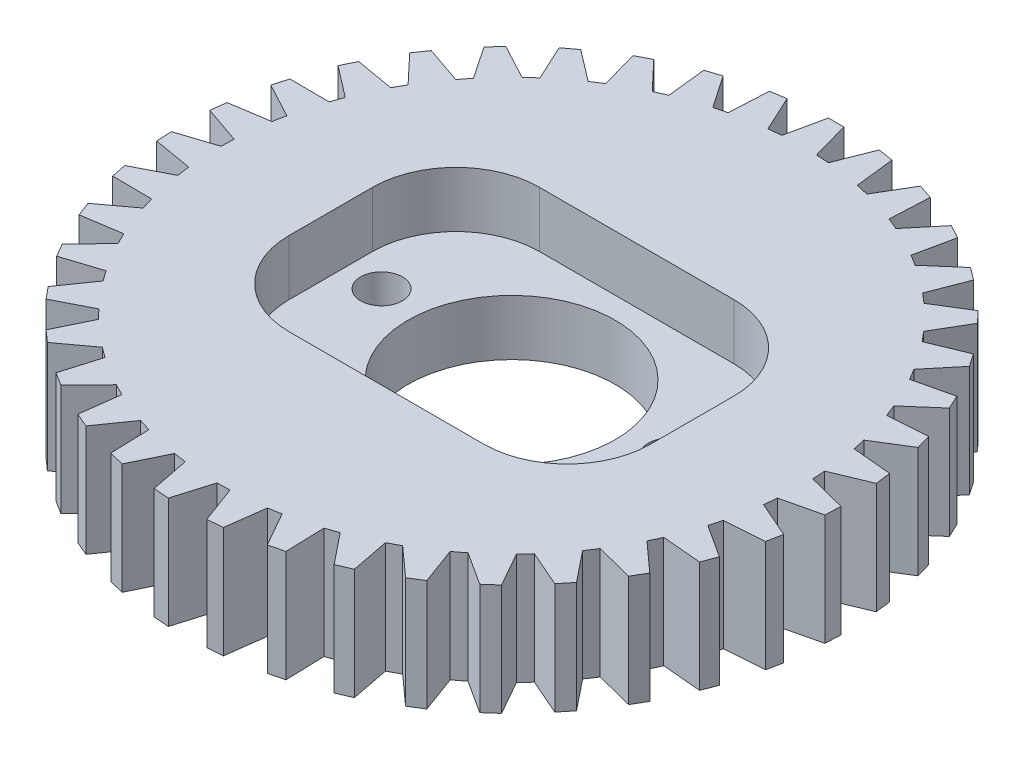
from build123d import *

# Parameters (mm, degrees)
SKETCH2_R           = 10.5
BOSS_EXTRUDE1_DEPTH = 4
SKETCH3_W           = 13
SKETCH3_H           = 9
CUT_EXTRUDE1_DEPTH  = 2
FILLET1_R           = 3
SKETCH4_R           = 3.725
SKETCH4_R_2         = 0.75
CUT_EXTRUDE2_DEPTH  = 15.983324064
BOSS_EXTRUDE2_START = -4
BOSS_EXTRUDE2_DEPTH = 4


with BuildPart() as part:
    # Sketch2 → Boss-Extrude1 (new body)
    with BuildSketch(Plane(origin=(0, 0, 0), x_dir=(1, 0, 0), z_dir=(0, 1, 0))):
        Circle(SKETCH2_R)
    extrude(amount=BOSS_EXTRUDE1_DEPTH)

    # Sketch3 → Cut-Extrude1 (cut)
    with BuildSketch(Plane(origin=(0, 4, 0), x_dir=(1, 0, 0), z_dir=(0, 1, 0))):
        Rectangle(SKETCH3_W, SKETCH3_H)
    extrude(amount=-CUT_EXTRUDE1_DEPTH, mode=Mode.SUBTRACT)

    # Fillet1
    fillet1_edges = [part.edges().sort_by_distance(p)[0] for p in [
        (-6.5, 3, 4.5),
        (6.5, 3, 4.5),
        (-6.5, 3, -4.5),
        (6.5, 3, -4.5),
    ]]
    fillet(fillet1_edges, radius=FILLET1_R)

    # Sketch4 → Cut-Extrude2 (cut, through all)
    with BuildSketch(Plane(origin=(0, 2, 0), x_dir=(1, 0, 0), z_dir=(0, 1, 0))):
        Circle(SKETCH4_R)
        with Locations((-5.176126951, 0.497704515)):
            Circle(SKETCH4_R_2)
        with Locations((5.176126951, 0.497704515)):
            Circle(SKETCH4_R_2)
    extrude(amount=-CUT_EXTRUDE2_DEPTH, mode=Mode.SUBTRACT)

    # Sketch5 → Boss-Extrude2 (add)
    with BuildSketch(Plane(origin=(0, 4, 0), x_dir=(1, 0, 0), z_dir=(0, 1, 0)).offset(BOSS_EXTRUDE2_START)):
        with BuildLine():
            Line((-0.757628273, 10.472630968), (-0.46141818, 11.853816835))
            Line((-0.46141818, 11.853816835), (0.093861365, 11.853816835))
            Line((0.093861365, 11.853816835), (0.477738985, 10.489126058))
            ThreePointArc((0.477738985, 10.489126058), (-0.140187465, 10.499064124), (-0.757628273, 10.472630968))
        make_face()
        with BuildLine():
            Line((1.994131826, 11.685256599), (2.154126537, 10.276659908))
            ThreePointArc((2.154126537, 10.276659908), (1.54579625, 10.385591652), (0.932110962, 10.45854527))
            Line((0.932110962, 10.45854527), (1.446043006, 11.774329702))
            Line((1.446043006, 11.774329702), (1.994131826, 11.685256599))
        make_face()
        with BuildLine():
            Line((3.842755321, 11.214054354), (3.774723342, 9.798033664))
            ThreePointArc((3.774723342, 9.798033664), (3.191744654, 10.003137811), (2.597709012, 10.173588742))
            Line((2.597709012, 10.173588742), (3.316052437, 11.389893614))
            Line((3.316052437, 11.389893614), (3.842755321, 11.214054354))
        make_face()
        with BuildLine():
            Line((5.591853472, 10.452413992), (5.297556797, 9.065643495))
            ThreePointArc((5.297556797, 9.065643495), (4.755028547, 9.361607956), (4.196027764, 9.62514161))
            Line((4.196027764, 9.62514161), (5.100177852, 10.710465264))
            Line((5.100177852, 10.710465264), (5.591853472, 10.452413992))
        make_face()
        with BuildLine():
            Line((7.196125554, 9.420061599), (6.683186312, 8.098457922))
            ThreePointArc((6.683186312, 8.098457922), (6.1951597, 8.477617371), (5.6856716, 8.827408366))
            Line((5.6856716, 8.827408366), (6.75221134, 9.75364149))
            Line((6.75221134, 9.75364149), (7.196125554, 9.420061599))
        make_face()
        with BuildLine():
            Line((8.614021765, 8.143734558), (7.895724813, 6.921526542))
            ThreePointArc((7.895724813, 6.921526542), (7.47483947, 7.37406095), (7.028059529, 7.801049882))
            Line((7.028059529, 7.801049882), (8.229366101, 8.544203525))
            Line((8.229366101, 8.544203525), (8.614021765, 8.143734558))
        make_face()
        with BuildLine():
            Line((9.808819337, 6.656489069), (8.903768189, 5.565331261))
            ThreePointArc((8.903768189, 5.565331261), (8.560924824, 6.079520224), (8.188424408, 6.572648304))
            Line((8.188424408, 6.572648304), (9.493384603, 7.113475176))
            Line((9.493384603, 7.113475176), (9.808819337, 6.656489069))
        make_face()
        with BuildLine():
            Line((10.74957364, 4.996844011), (9.681208645, 4.064996823))
            ThreePointArc((9.681208645, 4.064996823), (9.425286722, 4.627523118), (9.136713395, 5.174018587))
            Line((9.136713395, 5.174018587), (10.51152943, 5.498511557))
            Line((10.51152943, 5.498511557), (10.74957364, 4.996844011))
        make_face()
        with BuildLine():
            Line((11.411919633, 3.207783317), (10.207910883, 2.459381103))
            ThreePointArc((10.207910883, 2.459381103), (10.045538645, 3.055675593), (9.848366305, 3.641384506))
            Line((9.848366305, 3.641384506), (11.257431166, 3.741139377))
            Line((11.257431166, 3.741139377), (11.411919633, 3.207783317))
        make_face()
        with BuildLine():
            Line((11.778702901, 1.33564272), (10.470233591, 0.790068704))
            ThreePointArc((10.470233591, 0.790068704), (10.405616394, 1.404687676), (10.304951701, 2.01444048))
            Line((10.304951701, 2.01444048), (11.711771349, 1.886873652))
            Line((11.711771349, 1.886873652), (11.778702901, 1.33564272))
        make_face()
        with BuildLine():
            Line((11.840423952, -0.571090322), (10.461382748, -0.899706059))
            ThreePointArc((10.461382748, -0.899706059), (10.496194144, -0.282680914), (10.49464426, 0.335323503))
            Line((10.49464426, 0.335323503), (11.862782805, -0.01626111))
            Line((11.862782805, -0.01626111), (11.840423952, -0.571090322))
        make_face()
        with BuildLine():
            Line((11.595484241, -2.463032424), (10.181587588, -2.566178908))
            ThreePointArc((10.181587588, -2.566178908), (10.314925979, -1.962728218), (10.412531046, -1.352478176))
            Line((10.412531046, -1.352478176), (11.706554418, -1.918974717))
            Line((11.706554418, -1.918974717), (11.595484241, -2.463032424))
        make_face()
        with BuildLine():
            Line((11.05022758, -4.291183281), (9.638094657, -4.166189072))
            ThreePointArc((9.638094657, -4.166189072), (9.866506649, -3.591941891), (10.060738747, -3.005251381))
            Line((10.060738747, -3.005251381), (11.24713242, -3.771987887))
            Line((11.24713242, -3.771987887), (11.05022758, -4.291183281))
        make_face()
        with BuildLine():
            Line((10.218775829, -6.008194744), (8.844980137, -5.658297126))
            ThreePointArc((8.844980137, -5.658297126), (9.16254998, -5.128126156), (9.448378599, -4.580190153))
            Line((9.448378599, -4.580190153), (10.496415601, -5.527308552))
            Line((10.496415601, -5.527308552), (10.218775829, -6.008194744))
        make_face()
        with BuildLine():
            Line((9.122663151, -7.569597119), (7.822785278, -7.003858258))
            ThreePointArc((7.822785278, -7.003858258), (8.221288079, -6.531494647), (8.591310409, -6.036504407))
            Line((8.591310409, -6.036504407), (9.473847131, -7.139474829))
            Line((9.473847131, -7.139474829), (9.122663151, -7.569597119))
        make_face()
        with BuildLine():
            Line((7.79027829, -8.934950906), (6.597984389, -8.168023139))
            ThreePointArc((6.597984389, -8.168023139), (7.067099135, -7.765700858), (7.511731792, -7.336476367))
            Line((7.511731792, -7.336476367), (8.205910997, -8.566732458))
            Line((8.205910997, -8.566732458), (7.79027829, -8.934950906))
        make_face()
        with BuildLine():
            Line((6.256129313, -10.068894157), (5.20229917, -9.120640512))
            ThreePointArc((5.20229917, -9.120640512), (5.729876036, -8.798779496), (6.237603267, -8.446437443))
            Line((6.237603267, -8.446437443), (6.725446079, -9.772116216))
            Line((6.725446079, -9.772116216), (6.256129313, -10.068894157))
        make_face()
        with BuildLine():
            Line((4.559949873, -10.942058338), (3.671877136, -9.837038086))
            ThreePointArc((3.671877136, -9.837038086), (4.244252157, -9.603974366), (4.801924094, -9.337640226))
            Line((4.801924094, -9.337640226), (5.07079564, -10.724407297))
            Line((5.07079564, -10.724407297), (4.559949873, -10.942058338))
        make_face()
        with BuildLine():
            Line((2.745670126, -11.531828956), (2.046355412, -10.298661541))
            ThreePointArc((2.046355412, -10.298661541), (2.648704377, -10.160431345), (3.241877609, -9.987003032))
            Line((3.241877609, -9.987003032), (3.284814257, -11.398941863))
            Line((3.284814257, -11.398941863), (2.745670126, -11.531828956))
        make_face()
        with BuildLine():
            Line((0.860278966, -11.822931262), (0.367834158, -10.493555071))
            ThreePointArc((0.367834158, -10.493555071), (0.984556545, -10.45373849), (1.597868197, -10.377707706))
            Line((1.597868197, -10.377707706), (1.41375791, -11.778249822))
            Line((1.41375791, -11.778249822), (0.860278966, -11.822931262))
        make_face()
        with BuildLine():
            Line((-1.047392968, -11.807825858), (-1.320213807, -10.416671037))
            ThreePointArc((-1.320213807, -10.416671037), (-0.705090784, -10.476299298), (-0.087525162, -10.499635201))
            Line((-0.087525162, -10.499635201), (-0.493914024, -11.852507297))
            Line((-0.493914024, -11.852507297), (-1.047392968, -11.807825858))
        make_face()
        with BuildLine():
            Line((-2.927937974, -11.486903966), (-2.974068929, -10.070000696))
            ThreePointArc((-2.974068929, -10.070000696), (-2.376476633, -10.227529458), (-1.770651665, -10.349627659))
            Line((-1.770651665, -10.349627659), (-2.388793844, -11.61979106))
            Line((-2.388793844, -11.61979106), (-2.927937974, -11.486903966))
        make_face()
        with BuildLine():
            Line((-4.732650925, -10.868477296), (-4.550897227, -9.462522625))
            ThreePointArc((-4.550897227, -9.462522625), (-3.986312985, -9.713871977), (-3.40791922, -9.931570198))
            Line((-3.40791922, -9.931570198), (-4.221805158, -11.086128337))
            Line((-4.221805158, -11.086128337), (-4.732650925, -10.868477296))
        make_face()
        with BuildLine():
            Line((-6.414790703, -9.968562773), (-6.009859678, -8.609970189))
            ThreePointArc((-6.009859678, -8.609970189), (-5.492905925, -8.948630314), (-4.956923458, -9.256290285))
            Line((-4.956923458, -9.256290285), (-5.945473936, -10.265340714))
            Line((-5.945473936, -10.265340714), (-6.414790703, -9.968562773))
        make_face()
        with BuildLine():
            Line((-7.93079077, -8.81046771), (-7.313169919, -7.534424048))
            ThreePointArc((-7.313169919, -7.534424048), (-6.857235486, -7.951623827), (-6.377545981, -8.341277316))
            Line((-6.377545981, -8.341277316), (-7.515158063, -9.178686158))
            Line((-7.515158063, -9.178686158), (-7.93079077, -8.81046771))
        make_face()
        with BuildLine():
            Line((-9.241387523, -7.424186162), (-8.427072902, -6.263740281))
            ThreePointArc((-8.427072902, -6.263740281), (-8.043966251, -6.748674459), (-7.632993414, -7.210229646))
            Line((-7.632993414, -7.210229646), (-8.890203543, -7.854308452))
            Line((-8.890203543, -7.854308452), (-9.241387523, -7.424186162))
        make_face()
        with BuildLine():
            Line((-10.312637193, -5.845622091), (-9.322719122, -4.830828932))
            ThreePointArc((-9.322719122, -4.830828932), (-9.022362515, -5.370937968), (-8.690750327, -5.892440815))
            Line((-8.690750327, -5.892440815), (-10.034997421, -6.326508283))
            Line((-10.034997421, -6.326508283), (-10.312637193, -5.845622091))
        make_face()
        with BuildLine():
            Line((-11.116794977, -4.115659479), (-9.976911815, -3.27280165))
            ThreePointArc((-9.976911815, -3.27280165), (-9.767084328, -3.854097005), (-9.523421371, -4.422040863))
            Line((-9.523421371, -4.422040863), (-10.919890137, -4.634854873))
            Line((-10.919890137, -4.634854873), (-11.116794977, -4.115659479))
        make_face()
        with BuildLine():
            Line((-11.633033611, -2.279103449), (-10.372707732, -1.630010525))
            ThreePointArc((-10.372707732, -1.630010525), (-10.258843789, -2.237436953), (-10.109440804, -2.837112374))
            Line((-10.109440804, -2.837112374), (-11.521963434, -2.823161156))
            Line((-11.521963434, -2.823161156), (-11.633033611, -2.279103449))
        make_face()
        with BuildLine():
            Line((-11.847982784, -0.383519836), (-10.499855967, 0.054997016))
            ThreePointArc((-10.499855967, 0.054997016), (-10.484904583, -0.56282846), (-10.433631031, -1.178704166))
            Line((-10.433631031, -1.178704166), (-11.825623931, -0.938349048))
            Line((-11.825623931, -0.938349048), (-11.847982784, -0.383519836))
        make_face()
        with BuildLine():
            Line((-11.756075427, 1.521996739), (-10.355063448, 1.738580164))
            ThreePointArc((-10.355063448, 1.738580164), (-10.439411857, 1.126356995), (-10.487595694, 0.510231861))
            Line((-10.487595694, 0.510231861), (-11.82300698, 0.970765807))
            Line((-11.82300698, 0.970765807), (-11.756075427, 1.521996739))
        make_face()
        with BuildLine():
            Line((-11.359691891, 3.388094398), (-9.942080225, 3.377134998))
            ThreePointArc((-9.942080225, 3.377134998), (-10.123543847, 2.786370395), (-10.269937138, 2.185953151))
            Line((-10.269937138, 2.185953151), (-11.514180358, 2.854738338))
            Line((-11.514180358, 2.854738338), (-11.359691891, 3.388094398))
        make_face()
        with BuildLine():
            Line((-10.669098303, 5.166442192), (-9.271602347, 4.92822381))
            ThreePointArc((-9.271602347, 4.92822381), (-9.545481369, 4.374218265), (-9.786292605, 3.805059402))
            Line((-9.786292605, 3.805059402), (-10.907142513, 4.664774646))
            Line((-10.907142513, 4.664774646), (-10.669098303, 5.166442192))
        make_face()
        with BuildLine():
            Line((-9.702180672, 6.810981847), (-8.360994838, 6.351674214))
            ThreePointArc((-8.360994838, 6.351674214), (-8.720195938, 5.84877618), (-9.049188233, 5.325616614))
            Line((-9.049188233, 5.325616614), (-10.017615406, 6.35399574))
            Line((-10.017615406, 6.35399574), (-9.702180672, 6.810981847))
        make_face()
        with BuildLine():
            Line((-8.483981659, 8.27912065), (-7.233841954, 7.610619593))
            ThreePointArc((-7.233841954, 7.610619593), (-7.669062012, 7.171853865), (-8.07771464, 6.708243153))
            Line((-8.07771464, 6.708243153), (-8.868637322, 7.878651683))
            Line((-8.868637322, 7.878651683), (-8.483981659, 8.27912065))
        make_face()
        with BuildLine():
            Line((-7.046051977, 9.532834576), (-5.919336364, 8.672453921))
            ThreePointArc((-5.919336364, 8.672453921), (-6.419303409, 8.309184301), (-6.89703248, 7.917129717))
            Line((-6.89703248, 7.917129717), (-7.48996619, 9.199254685))
            Line((-7.48996619, 9.199254685), (-7.046051977, 9.532834576))
        make_face()
        with BuildLine():
            Line((-5.425633249, 10.539653095), (-4.451523071, 9.509676248))
            ThreePointArc((-4.451523071, 9.509676248), (-5.003288219, 9.231311229), (-5.537720803, 8.920966781))
            Line((-5.537720803, 8.920966781), (-5.917308868, 10.281601823))
            Line((-5.917308868, 10.281601823), (-5.425633249, 10.539653095))
        make_face()
        with BuildLine():
            Line((-3.664693471, 11.273500134), (-2.868417669, 10.100602956))
            ThreePointArc((-2.868417669, 10.100602956), (-3.457690492, 9.914352044), (-4.034985065, 9.693755491))
            Line((-4.034985065, 9.693755491), (-4.191396355, 11.097660875))
            Line((-4.191396355, 11.097660875), (-3.664693471, 11.273500134))
        make_face()
        with BuildLine():
            Line((-1.808840057, 11.715369442), (-1.211021756, 10.429929353))
            ThreePointArc((-1.211021756, 10.429929353), (-1.822540398, 10.34061635), (-2.427745333, 10.215481026))
            Line((-2.427745333, 10.215481026), (-2.356928878, 11.626296339))
            Line((-2.356928878, 11.626296339), (-1.808840057, 11.715369442))
        make_face()
    extrude(amount=BOSS_EXTRUDE2_DEPTH)


solid = part.part
